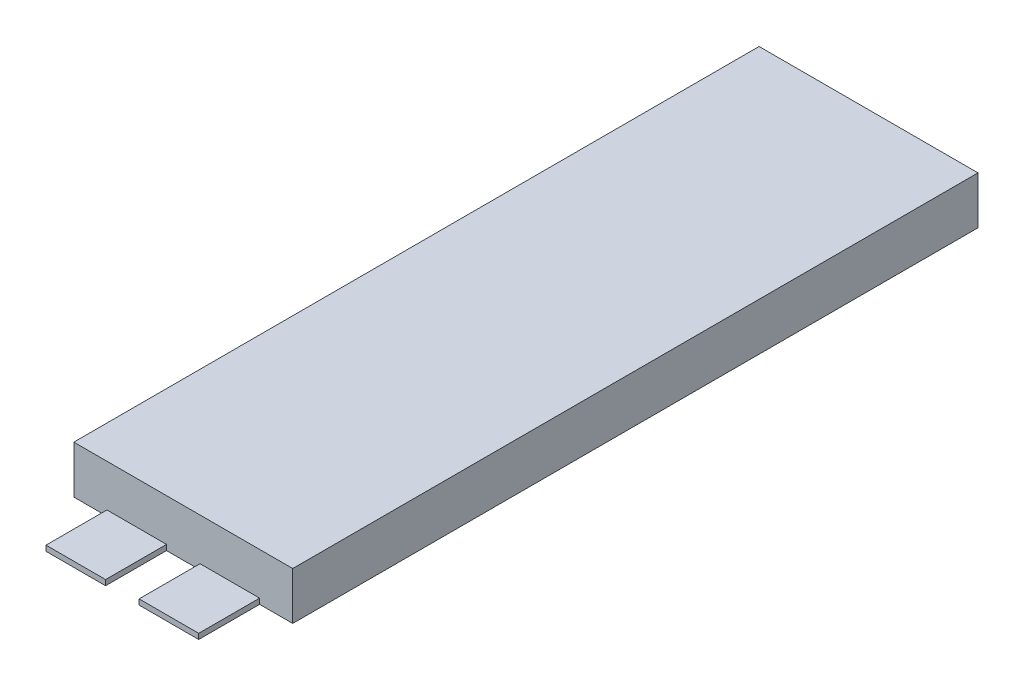
from build123d import *

# Parameters (mm, degrees)
SKETCH1_W           = 46
SKETCH1_H           = 144
CELL_DEPTH          = 10
SKETCH2_W           = 12.525135801
SKETCH2_H           = 1.132917149
BOSS_EXTRUDE1_DEPTH = 12.8


with BuildPart() as part:
    # Sketch1 → cell (new body)
    with BuildSketch(Plane(origin=(0, 0, 0), x_dir=(1, 0, 0), z_dir=(0, 1, 0))):
        Rectangle(SKETCH1_W, SKETCH1_H)
    extrude(amount=CELL_DEPTH)

    # Sketch2 → Boss-Extrude1 (add)
    with BuildSketch(Plane.XY.offset(72)):
        with Locations((-9.780847428, 0.566458575)):
            Rectangle(SKETCH2_W, SKETCH2_H)
        with Locations((9.780847428, 0.566458575)):
            Rectangle(SKETCH2_W, SKETCH2_H)
    extrude(amount=BOSS_EXTRUDE1_DEPTH)


solid = part.part
